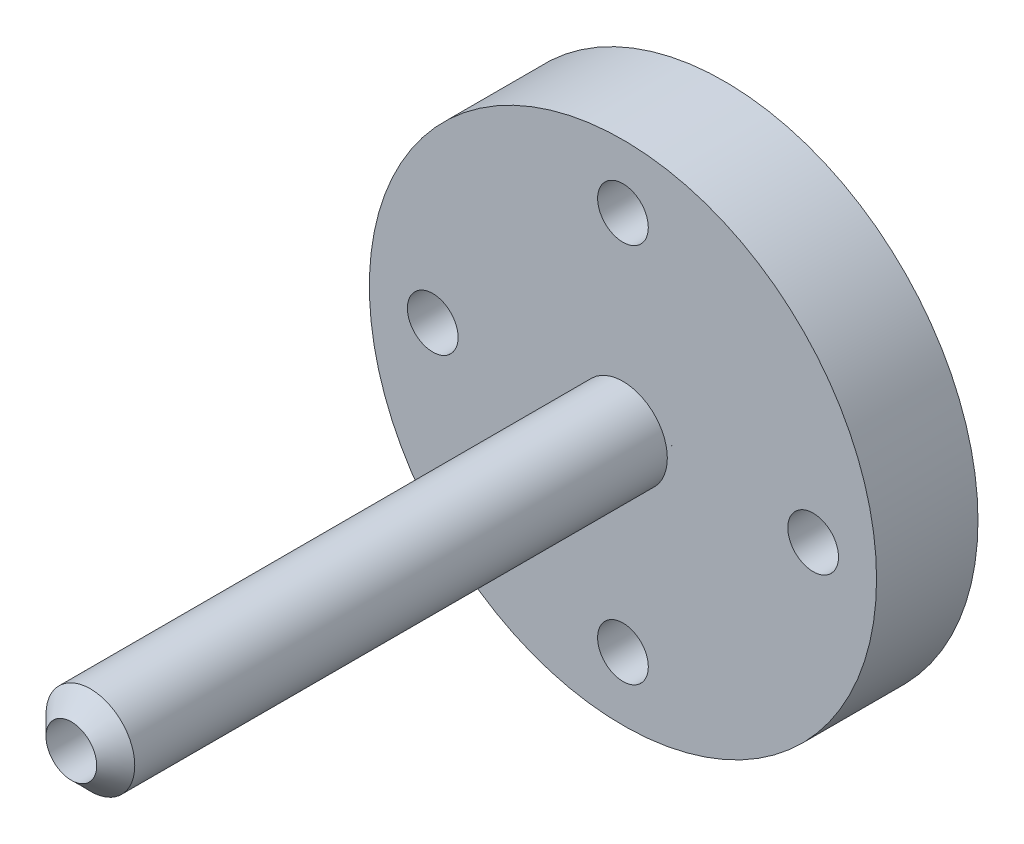
from build123d import *

# Parameters (mm, degrees)
SKETCH1_R           = 10
SKETCH1_R_2         = 1
BOSS_EXTRUDE1_DEPTH = 4
SKETCH2_R           = 1.75
SKETCH2_R_2         = 1
BOSS_EXTRUDE2_DEPTH = 22
CHAMFER1_SIZE       = 1
SKETCH3_R           = 1
CUT_EXTRUDE1_DEPTH  = 26.943448113


with BuildPart() as part:
    # Sketch1 → Boss-Extrude1 (new body)
    with BuildSketch(Plane.XY):
        Circle(SKETCH1_R)
        Circle(SKETCH1_R_2, mode=Mode.SUBTRACT)
    extrude(amount=BOSS_EXTRUDE1_DEPTH)

    # Sketch2 → Boss-Extrude2 (add)
    with BuildSketch(Plane.XY.offset(4)):
        Circle(SKETCH2_R)
        Circle(SKETCH2_R_2, mode=Mode.SUBTRACT)
    extrude(amount=BOSS_EXTRUDE2_DEPTH)

    # Chamfer1
    # the kernel refuses this chamfer: 1 mm, written as the material it takes off along each edge
    with BuildSketch(Plane(origin=(0, 0, 26), x_dir=(1, 0, 0), z_dir=(0, -1, 0))) as chamfer1_piece_1:
        Polygon((1.75, -CHAMFER1_SIZE), (1.75 - CHAMFER1_SIZE, 0), (1.75, 0), align=None)
    revolve(axis=Axis((0, 0, 26), (0, 0, 1)), mode=Mode.SUBTRACT)

    # Sketch3 → Cut-Extrude1 (cut, through all)
    with BuildSketch(Plane.XY.offset(4)):
        with Locations((0, 7.5)):
            Circle(SKETCH3_R)
        with Locations((-7.5, 0)):
            Circle(SKETCH3_R)
        with Locations((7.5, 0)):
            Circle(SKETCH3_R)
        with Locations((0, -7.5)):
            Circle(SKETCH3_R)
    extrude(amount=-CUT_EXTRUDE1_DEPTH, mode=Mode.SUBTRACT)


solid = part.part
